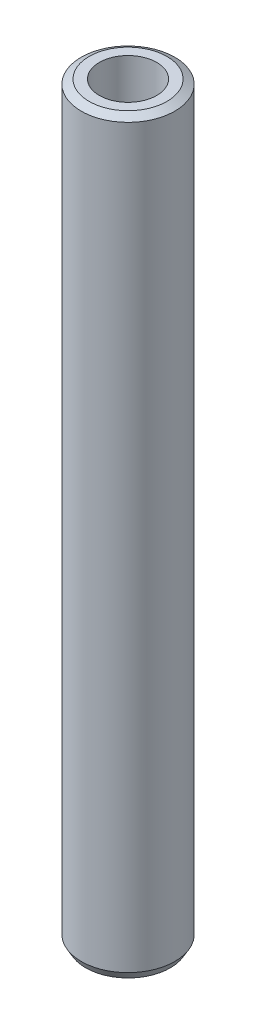
from build123d import *
from OCP.BRepFilletAPI import BRepFilletAPI_MakeChamfer

# Parameters (mm, degrees)
SKETCH1_R           = 37.5
BOSS_EXTRUDE1_DEPTH = 600
SKETCH2_R           = 22.99264774
CUT_EXTRUDE1_DEPTH  = 603.339190158
CHAMFER1_SIZE       = 3.632275466
CHAMFER1_SIZE2      = 6.291285654


with BuildPart() as part:
    # Sketch1 → Boss-Extrude1 (new body)
    with BuildSketch(Plane(origin=(0, 0, 0), x_dir=(1, 0, 0), z_dir=(0, 1, 0))):
        Circle(SKETCH1_R)
    extrude(amount=BOSS_EXTRUDE1_DEPTH)

    # Sketch2 → Cut-Extrude1 (cut, through all)
    with BuildSketch(Plane(origin=(0, 0, 0), x_dir=(1, 0, 0), z_dir=(0, 1, 0))):
        Circle(SKETCH2_R)
    extrude(amount=CUT_EXTRUDE1_DEPTH, mode=Mode.SUBTRACT)

    # Chamfer1: one chamfer whose edges measure the first distance from different faces: ONE call of the kernel's chamfer builder (chamfer() names one face for all edges)
    chamfer1_edges_1 = [part.edges().sort_by_distance(p)[0] for p in [
        (-37.5, 600, 0),
    ]]
    chamfer1_side_1 = [part.faces().sort_by_distance(p)[0] for p in [
        (-37.5, 300, 0),
    ]]
    chamfer1_edges_2 = [part.edges().sort_by_distance(p)[0] for p in [
        (-37.5, 0, 0),
    ]]
    chamfer1_side_2 = [part.faces().sort_by_distance(p)[0] for p in [
        (-36.439339828, 0, 0),
    ]]
    chamfer1 = BRepFilletAPI_MakeChamfer(part.part.solid().wrapped)
    for e in chamfer1_edges_1:
        chamfer1.Add(CHAMFER1_SIZE, CHAMFER1_SIZE2, e.wrapped, chamfer1_side_1[0].wrapped)  # the first distance lies on this face
    for e in chamfer1_edges_2:
        chamfer1.Add(CHAMFER1_SIZE, CHAMFER1_SIZE2, e.wrapped, chamfer1_side_2[0].wrapped)  # the first distance lies on this face
    add(Compound.cast(chamfer1.Shape()), mode=Mode.REPLACE)


solid = part.part
